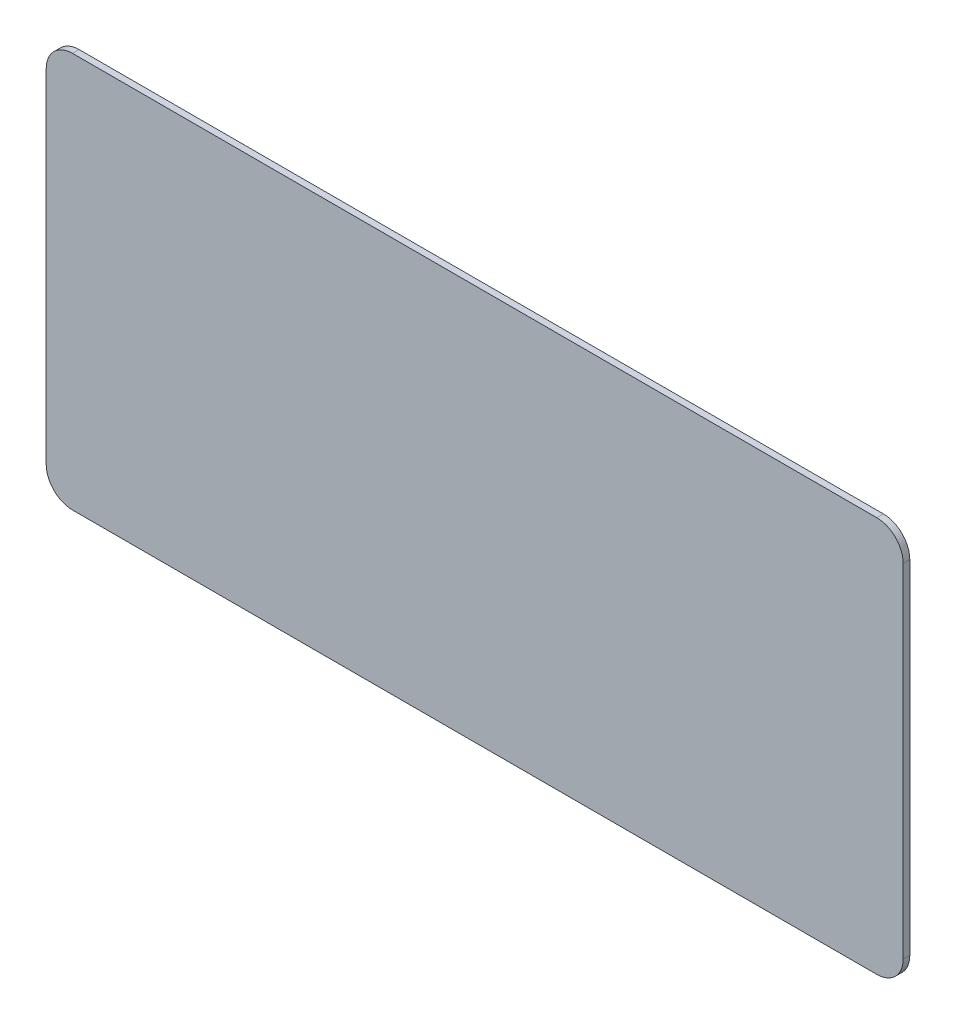
from build123d import *

# Parameters (mm, degrees)
BOSS_EXTRUDE1_DEPTH = 0.5
BOSS_EXTRUDE2_DEPTH = 0.5


with BuildPart() as part:
    # Sketch1 → Boss-Extrude1 (new body)
    with BuildSketch(Plane.XY):
        with BuildLine():
            Line((93.44074046, -13.055), (93.44074046, 12.945))
            ThreePointArc((93.44074046, 12.945), (94.026526898, 14.359213562), (95.44074046, 14.945))
            Line((95.44074046, 14.945), (156.44074046, 14.945))
            ThreePointArc((156.44074046, 14.945), (157.854954022, 14.359213562), (158.44074046, 12.945))
            Line((158.44074046, 12.945), (158.44074046, -13.055))
            ThreePointArc((158.44074046, -13.055), (157.854954022, -14.469213562), (156.44074046, -15.055))
            Line((156.44074046, -15.055), (95.44074046, -15.055))
            ThreePointArc((95.44074046, -15.055), (94.026526898, -14.469213562), (93.44074046, -13.055))
        make_face()
    extrude(amount=-BOSS_EXTRUDE1_DEPTH)


with BuildPart() as body_2:
    # Sketch2 → Boss-Extrude2 (new body)
    with BuildSketch(Plane(origin=(0, 0, -0.5), x_dir=(-1, 0, 0), z_dir=(0, 0, -1))):
        with BuildLine():
            Line((-148.44074046, 9.445), (-103.44074046, 9.445))
            ThreePointArc((-103.44074046, 9.445), (-101.672973507, 8.712766953), (-100.94074046, 6.945))
            Line((-100.94074046, 6.945), (-100.94074046, -7.055))
            ThreePointArc((-100.94074046, -7.055), (-101.672973507, -8.822766953), (-103.44074046, -9.555))
            Line((-103.44074046, -9.555), (-148.44074046, -9.555))
            ThreePointArc((-148.44074046, -9.555), (-150.208507413, -8.822766953), (-150.94074046, -7.055))
            Line((-150.94074046, -7.055), (-150.94074046, 6.945))
            ThreePointArc((-150.94074046, 6.945), (-150.208507413, 8.712766953), (-148.44074046, 9.445))
        make_face()
    extrude(amount=BOSS_EXTRUDE2_DEPTH)


solid = Compound([part.part, body_2.part])
